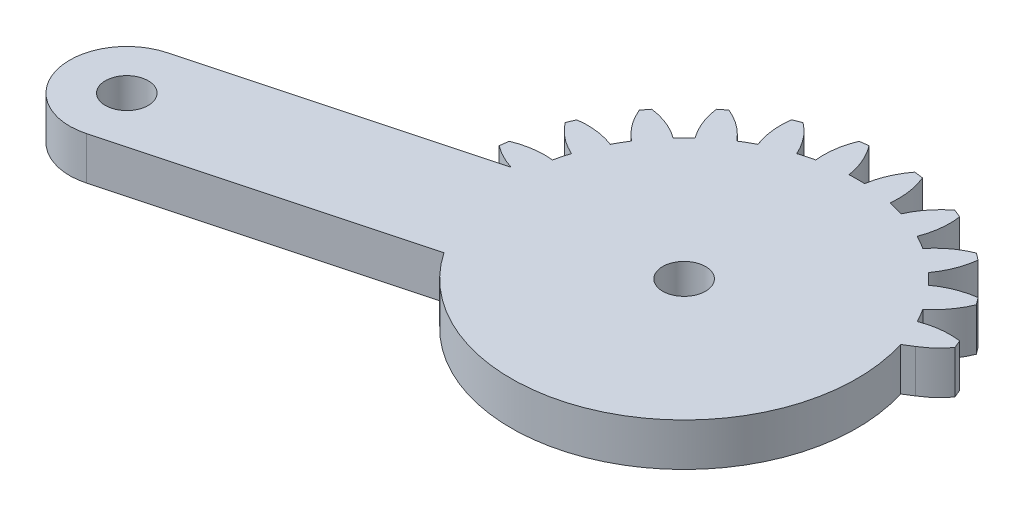
from build123d import *
from build123d.topology import SkipClean

# Parameters (mm, degrees)
SKETCH1_R           = 1.5
BOSS_EXTRUDE1_DEPTH = 3
BOSS_EXTRUDE2_START = -3
SKETCH3_R           = 1.5
BOSS_EXTRUDE2_DEPTH = 3
CUT_EXTRUDE1_START  = -3
CUT_EXTRUDE1_DEPTH  = 3


with BuildPart() as part:
    # Sketch1 → Boss-Extrude1 (new body)
    with BuildSketch(Plane(origin=(0, 0, 0), x_dir=(1, 0, 0), z_dir=(0, 1, 0))):
        with BuildLine():
            Line((20.643657446, 4), (2.081641936, 4))
            ThreePointArc((2.081641936, 4), (2.861028333, 4.588201733), (3.521749436, 5.30713988))
            ThreePointArc((3.521749436, 5.30713988), (3.405395609, 5.596745198), (3.282888305, 5.883801663))
            ThreePointArc((3.282888305, 5.883801663), (1.93527598, 5.894040025), (0.627094961, 5.57027124))
            ThreePointArc((0.627094961, 5.57027124), (0.366286148, 6.046375), (0.084372603, 6.510293938))
            ThreePointArc((0.084372603, 6.510293938), (1.018855105, 7.48132754), (1.683794586, 8.65351323))
            ThreePointArc((1.683794586, 8.65351323), (1.496450048, 8.903135899), (1.303821399, 9.148703928))
            ThreePointArc((1.303821399, 9.148703928), (-0.000522033, 8.809805691), (-1.180330337, 8.158486898))
            ThreePointArc((-1.180330337, 8.158486898), (-1.555477026, 8.550865528), (-1.947855656, 8.926012217))
            ThreePointArc((-1.947855656, 8.926012217), (-1.296536862, 10.105820521), (-0.957638625, 11.410163953))
            ThreePointArc((-0.957638625, 11.410163953), (-1.203206655, 11.602792602), (-1.452829324, 11.79013714))
            ThreePointArc((-1.452829324, 11.79013714), (-2.625015014, 11.125197659), (-3.596048616, 10.190715157))
            ThreePointArc((-3.596048616, 10.190715157), (-4.059967554, 10.472628702), (-4.536071314, 10.733437515))
            ThreePointArc((-4.536071314, 10.733437515), (-4.212302529, 12.041618533), (-4.222540891, 13.389230859))
            ThreePointArc((-4.222540891, 13.389230859), (-4.509597355, 13.511738163), (-4.799202674, 13.62809199))
            ThreePointArc((-4.799202674, 13.62809199), (-5.759348103, 12.682425791), (-6.455432668, 11.528463019))
            ThreePointArc((-6.455432668, 11.528463019), (-6.976508546, 11.680699536), (-7.503891752, 11.809396783))
            ThreePointArc((-7.503891752, 11.809396783), (-7.529737283, 13.156800143), (-7.888414517, 14.455843809))
            ThreePointArc((-7.888414517, 14.455843809), (-8.197396993, 14.499881098), (-8.507248835, 14.537314892))
            ThreePointArc((-8.507248835, 14.537314892), (-9.18992168, 13.375367565), (-9.563620196, 12.080565177))
            ThreePointArc((-9.563620196, 12.080565177), (-10.106342554, 12.09275), (-10.649064912, 12.080565177))
            ThreePointArc((-10.649064912, 12.080565177), (-11.022763428, 13.375367565), (-11.705436272, 14.537314892))
            ThreePointArc((-11.705436272, 14.537314892), (-12.015288115, 14.499881098), (-12.324270591, 14.455843809))
            ThreePointArc((-12.324270591, 14.455843809), (-12.682947825, 13.156800143), (-12.708793355, 11.809396783))
            ThreePointArc((-12.708793355, 11.809396783), (-13.236176561, 11.680699536), (-13.757252439, 11.528463019))
            ThreePointArc((-13.757252439, 11.528463019), (-14.453337005, 12.682425791), (-15.413482434, 13.62809199))
            ThreePointArc((-15.413482434, 13.62809199), (-15.703087752, 13.511738163), (-15.990144217, 13.389230859))
            ThreePointArc((-15.990144217, 13.389230859), (-16.000382579, 12.041618533), (-15.676613793, 10.733437515))
            ThreePointArc((-15.676613793, 10.733437515), (-16.152717554, 10.472628702), (-16.616636492, 10.190715157))
            ThreePointArc((-16.616636492, 10.190715157), (-17.587670094, 11.125197659), (-18.759855783, 11.79013714))
            ThreePointArc((-18.759855783, 11.79013714), (-19.009478453, 11.602792602), (-19.255046482, 11.410163953))
            ThreePointArc((-19.255046482, 11.410163953), (-18.916148245, 10.105820521), (-18.264829452, 8.926012217))
            ThreePointArc((-18.264829452, 8.926012217), (-18.657208082, 8.550865528), (-19.032354771, 8.158486898))
            ThreePointArc((-19.032354771, 8.158486898), (-20.212163074, 8.809805691), (-21.516506507, 9.148703928))
            ThreePointArc((-21.516506507, 9.148703928), (-21.709135156, 8.903135899), (-21.896479694, 8.65351323))
            ThreePointArc((-21.896479694, 8.65351323), (-21.231540213, 7.48132754), (-20.297057711, 6.510293938))
            ThreePointArc((-20.297057711, 6.510293938), (-20.578971255, 6.046375), (-20.839780068, 5.57027124))
            ThreePointArc((-20.839780068, 5.57027124), (-22.147961087, 5.894040025), (-23.495573413, 5.883801663))
            ThreePointArc((-23.495573413, 5.883801663), (-23.618080717, 5.596745198), (-23.734434544, 5.30713988))
            ThreePointArc((-23.734434544, 5.30713988), (-22.788768345, 4.346994451), (-21.634805572, 3.650909885))
            ThreePointArc((-21.634805572, 3.650909885), (-21.78704209, 3.129834008), (-21.915739337, 2.602450802))
            ThreePointArc((-21.915739337, 2.602450802), (-23.263142697, 2.576605271), (-24.562186363, 2.217928037))
            ThreePointArc((-24.562186363, 2.217928037), (-24.606223651, 1.908945561), (-24.643657446, 1.599093719))
            ThreePointArc((-24.643657446, 1.599093719), (-23.481710119, 0.916420874), (-22.186907731, 0.542722358))
            ThreePointArc((-22.186907731, 0.542722358), (-22.199092554, 0), (-22.186907731, -0.542722358))
            ThreePointArc((-22.186907731, -0.542722358), (-23.481710119, -0.916420874), (-24.643657446, -1.599093719))
            ThreePointArc((-24.643657446, -1.599093719), (-24.606223651, -1.908945561), (-24.562186363, -2.217928037))
            ThreePointArc((-24.562186363, -2.217928037), (-23.263142697, -2.576605271), (-21.915739337, -2.602450802))
            ThreePointArc((-21.915739337, -2.602450802), (-21.78704209, -3.129834008), (-21.634805572, -3.650909885))
            ThreePointArc((-21.634805572, -3.650909885), (-22.788768345, -4.346994451), (-23.734434544, -5.30713988))
            ThreePointArc((-23.734434544, -5.30713988), (-23.618080717, -5.596745198), (-23.495573413, -5.883801663))
            ThreePointArc((-23.495573413, -5.883801663), (-22.147961087, -5.894040025), (-20.839780068, -5.57027124))
            ThreePointArc((-20.839780068, -5.57027124), (-20.578971255, -6.046375), (-20.297057711, -6.510293938))
            ThreePointArc((-20.297057711, -6.510293938), (-21.231540213, -7.48132754), (-21.896479694, -8.65351323))
            ThreePointArc((-21.896479694, -8.65351323), (-21.709135156, -8.903135899), (-21.516506507, -9.148703928))
            ThreePointArc((-21.516506507, -9.148703928), (-20.212163074, -8.809805691), (-19.032354771, -8.158486898))
            ThreePointArc((-19.032354771, -8.158486898), (-18.657208082, -8.550865528), (-18.264829452, -8.926012217))
            ThreePointArc((-18.264829452, -8.926012217), (-18.916148245, -10.105820521), (-19.255046482, -11.410163953))
            ThreePointArc((-19.255046482, -11.410163953), (-19.009478453, -11.602792602), (-18.759855783, -11.79013714))
            ThreePointArc((-18.759855783, -11.79013714), (-17.587670094, -11.125197659), (-16.616636492, -10.190715157))
            ThreePointArc((-16.616636492, -10.190715157), (-16.152717554, -10.472628702), (-15.676613793, -10.733437515))
            ThreePointArc((-15.676613793, -10.733437515), (-16.000382579, -12.041618533), (-15.990144217, -13.389230859))
            ThreePointArc((-15.990144217, -13.389230859), (-15.703087752, -13.511738163), (-15.413482434, -13.62809199))
            ThreePointArc((-15.413482434, -13.62809199), (-14.453337005, -12.682425791), (-13.757252439, -11.528463019))
            ThreePointArc((-13.757252439, -11.528463019), (-13.236176561, -11.680699536), (-12.708793355, -11.809396783))
            ThreePointArc((-12.708793355, -11.809396783), (-12.682947825, -13.156800143), (-12.324270591, -14.455843809))
            ThreePointArc((-12.324270591, -14.455843809), (-12.015288115, -14.499881098), (-11.705436272, -14.537314892))
            ThreePointArc((-11.705436272, -14.537314892), (-11.022763428, -13.375367565), (-10.649064912, -12.080565177))
            ThreePointArc((-10.649064912, -12.080565177), (-10.106342554, -12.09275), (-9.563620196, -12.080565177))
            ThreePointArc((-9.563620196, -12.080565177), (-9.18992168, -13.375367565), (-8.507248835, -14.537314892))
            ThreePointArc((-8.507248835, -14.537314892), (-8.197396993, -14.499881098), (-7.888414517, -14.455843809))
            ThreePointArc((-7.888414517, -14.455843809), (-7.529737283, -13.156800143), (-7.503891752, -11.809396783))
            ThreePointArc((-7.503891752, -11.809396783), (-6.976508546, -11.680699536), (-6.455432668, -11.528463019))
            ThreePointArc((-6.455432668, -11.528463019), (-5.759348103, -12.682425791), (-4.799202674, -13.62809199))
            ThreePointArc((-4.799202674, -13.62809199), (-4.509597355, -13.511738163), (-4.222540891, -13.389230859))
            ThreePointArc((-4.222540891, -13.389230859), (-4.212302529, -12.041618533), (-4.536071314, -10.733437515))
            ThreePointArc((-4.536071314, -10.733437515), (-4.059967554, -10.472628702), (-3.596048616, -10.190715157))
            ThreePointArc((-3.596048616, -10.190715157), (-2.625015014, -11.125197659), (-1.452829324, -11.79013714))
            ThreePointArc((-1.452829324, -11.79013714), (-1.203206655, -11.602792602), (-0.957638625, -11.410163953))
            ThreePointArc((-0.957638625, -11.410163953), (-1.296536862, -10.105820521), (-1.947855656, -8.926012217))
            ThreePointArc((-1.947855656, -8.926012217), (-1.555477026, -8.550865528), (-1.180330337, -8.158486898))
            ThreePointArc((-1.180330337, -8.158486898), (-0.000522033, -8.809805691), (1.303821399, -9.148703928))
            ThreePointArc((1.303821399, -9.148703928), (1.496450048, -8.903135899), (1.683794586, -8.65351323))
            ThreePointArc((1.683794586, -8.65351323), (1.018855105, -7.48132754), (0.084372603, -6.510293938))
            ThreePointArc((0.084372603, -6.510293938), (0.366286148, -6.046375), (0.627094961, -5.57027124))
            ThreePointArc((0.627094961, -5.57027124), (1.93527598, -5.894040025), (3.282888305, -5.883801663))
            ThreePointArc((3.282888305, -5.883801663), (3.405395609, -5.596745198), (3.521749436, -5.30713988))
            ThreePointArc((3.521749436, -5.30713988), (2.861028333, -4.588201733), (2.081641936, -4))
            Line((2.081641936, -4), (20.643657446, -4))
            ThreePointArc((20.643657446, -4), (24.643657446, 0), (20.643657446, 4))
        make_face()
        with Locations((-10.106342554, 0)):
            Circle(SKETCH1_R, mode=Mode.SUBTRACT)
        with Locations((20.643657446, 0)):
            Circle(SKETCH1_R, mode=Mode.SUBTRACT)
    extrude(amount=BOSS_EXTRUDE1_DEPTH)

    # Sketch3 → Boss-Extrude2 (add)
    with BuildSketch(Plane(origin=(0, 3, 0), x_dir=(1, 0, 0), z_dir=(0, 1, 0)).offset(BOSS_EXTRUDE2_START)):
        with BuildLine():
            Line((-11.141618734, 3.863703305), (-41.891618734, -4.375734362))
            ThreePointArc((-41.891618734, -4.375734362), (-44.720045859, -9.274713848), (-39.821066373, -12.103140972))
            Line((-39.821066373, -12.103140972), (-9.071066373, -3.863703305))
            ThreePointArc((-9.071066373, -3.863703305), (-6.242639249, 1.03527618), (-11.141618734, 3.863703305))
        make_face()
        with Locations((-10.106342554, 0)):
            Circle(SKETCH3_R, mode=Mode.SUBTRACT)
        with Locations((-40.856342554, -8.239437667)):
            Circle(SKETCH3_R, mode=Mode.SUBTRACT)
    extrude(amount=BOSS_EXTRUDE2_DEPTH)

    # Sketch4 → Cut-Extrude1 (cut)
    with SkipClean():  # the faces are left unmerged after this step: merging them gives an invalid solid
        with BuildSketch(Plane(origin=(0, 3, 0), x_dir=(1, 0, 0), z_dir=(0, 1, 0)).offset(CUT_EXTRUDE1_START)):
            with BuildLine():
                ThreePointArc((20.643657446, -4), (24.643657446, 0), (20.643657446, 4))
                Line((20.643657446, 4), (2.081641936, 4))
                Line((2.081641936, 4), (1.43808022, 3.600125745))
                ThreePointArc((1.43808022, 3.600125745), (1.939395696, -1.065266441), (0.627094961, -5.57027124))
                ThreePointArc((0.627094961, -5.57027124), (1.93527598, -5.894040025), (3.282888305, -5.883801663))
                ThreePointArc((3.282888305, -5.883801663), (3.405395609, -5.596745198), (3.521749436, -5.30713988))
                ThreePointArc((3.521749436, -5.30713988), (2.861028333, -4.588201733), (2.081641936, -4))
                Line((2.081641936, -4), (20.643657446, -4))
            make_face()
            with BuildLine():
                ThreePointArc((1.683794586, -8.65351323), (1.018855105, -7.48132754), (0.084372603, -6.510293938))
                ThreePointArc((0.084372603, -6.510293938), (-0.512518948, -7.361599771), (-1.180330337, -8.158486898))
                ThreePointArc((-1.180330337, -8.158486898), (-0.000522033, -8.809805691), (1.303821399, -9.148703928))
                ThreePointArc((1.303821399, -9.148703928), (1.496450048, -8.903135899), (1.683794586, -8.65351323))
            make_face()
            with BuildLine():
                ThreePointArc((-0.957638625, -11.410163953), (-1.296536862, -10.105820521), (-1.947855656, -8.926012217))
                ThreePointArc((-1.947855656, -8.926012217), (-2.744742783, -9.593823606), (-3.596048616, -10.190715157))
                ThreePointArc((-3.596048616, -10.190715157), (-2.625015014, -11.125197659), (-1.452829324, -11.79013714))
                ThreePointArc((-1.452829324, -11.79013714), (-1.203206655, -11.602792602), (-0.957638625, -11.410163953))
            make_face()
            with BuildLine():
                ThreePointArc((-4.222540891, -13.389230859), (-4.212302529, -12.041618533), (-4.536071314, -10.733437515))
                ThreePointArc((-4.536071314, -10.733437515), (-5.478647477, -11.172244217), (-6.455432668, -11.528463019))
                ThreePointArc((-6.455432668, -11.528463019), (-5.759348103, -12.682425791), (-4.799202674, -13.62809199))
                ThreePointArc((-4.799202674, -13.62809199), (-4.509597355, -13.511738163), (-4.222540891, -13.389230859))
            make_face()
            with BuildLine():
                ThreePointArc((-7.888414517, -14.455843809), (-7.529737283, -13.156800143), (-7.503891752, -11.809396783))
                ThreePointArc((-7.503891752, -11.809396783), (-8.527921943, -11.989294847), (-9.563620196, -12.080565177))
                ThreePointArc((-9.563620196, -12.080565177), (-9.18992168, -13.375367565), (-8.507248835, -14.537314892))
                ThreePointArc((-8.507248835, -14.537314892), (-8.197396993, -14.499881098), (-7.888414517, -14.455843809))
            make_face()
            with BuildLine():
                ThreePointArc((-11.705436272, -14.537314892), (-11.022763428, -13.375367565), (-10.649064912, -12.080565177))
                ThreePointArc((-10.649064912, -12.080565177), (-11.684763165, -11.989294847), (-12.708793355, -11.809396783))
                ThreePointArc((-12.708793355, -11.809396783), (-12.682947825, -13.156800143), (-12.324270591, -14.455843809))
                ThreePointArc((-12.324270591, -14.455843809), (-12.015288115, -14.499881098), (-11.705436272, -14.537314892))
            make_face()
            with BuildLine():
                ThreePointArc((-15.413482434, -13.62809199), (-14.453337005, -12.682425791), (-13.757252439, -11.528463019))
                ThreePointArc((-13.757252439, -11.528463019), (-14.734037631, -11.172244217), (-15.676613793, -10.733437515))
                ThreePointArc((-15.676613793, -10.733437515), (-16.000382579, -12.041618533), (-15.990144217, -13.389230859))
                ThreePointArc((-15.990144217, -13.389230859), (-15.703087752, -13.511738163), (-15.413482434, -13.62809199))
            make_face()
            with BuildLine():
                ThreePointArc((-18.759855783, -11.79013714), (-17.587670094, -11.125197659), (-16.616636492, -10.190715157))
                ThreePointArc((-16.616636492, -10.190715157), (-17.467942324, -9.593823606), (-18.264829452, -8.926012217))
                ThreePointArc((-18.264829452, -8.926012217), (-18.916148245, -10.105820521), (-19.255046482, -11.410163953))
                ThreePointArc((-19.255046482, -11.410163953), (-19.009478453, -11.602792602), (-18.759855783, -11.79013714))
            make_face()
            with BuildLine():
                ThreePointArc((-21.516506507, -9.148703928), (-20.212163074, -8.809805691), (-19.032354771, -8.158486898))
                ThreePointArc((-19.032354771, -8.158486898), (-19.58704562, -7.506721784), (-20.094248238, -6.817355984))
                Line((-20.094248238, -6.817355984), (-20.843755363, -7.018185813))
                ThreePointArc((-20.843755363, -7.018185813), (-21.444347002, -7.788065101), (-21.896479694, -8.65351323))
                ThreePointArc((-21.896479694, -8.65351323), (-21.709135156, -8.903135899), (-21.516506507, -9.148703928))
            make_face()
        extrude(amount=CUT_EXTRUDE1_DEPTH, mode=Mode.SUBTRACT)


solid = part.part
